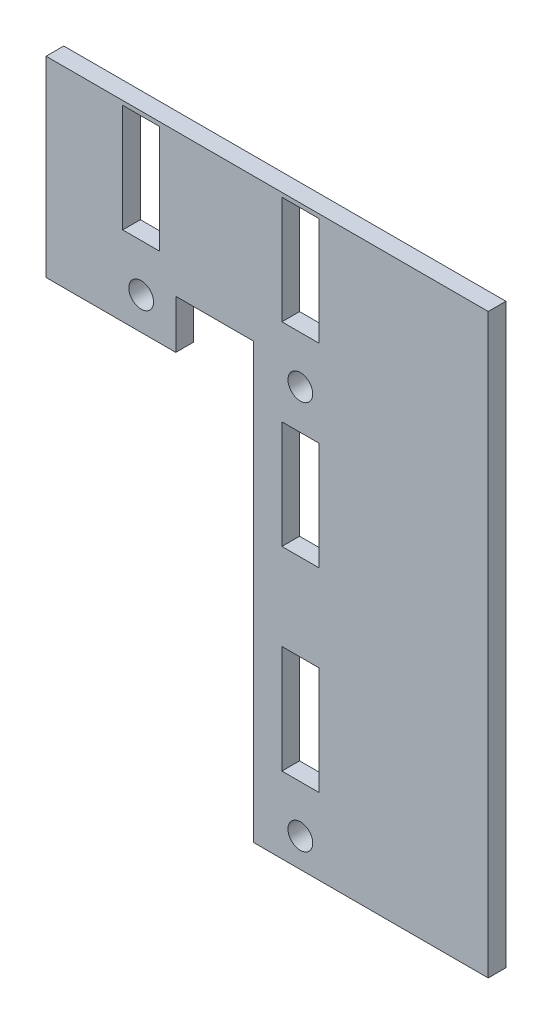
from build123d import *

# Parameters (mm, degrees)
SKETCH1_W           = 101.6
SKETCH1_H           = 50.8
BOSS_EXTRUDE1_DEPTH = 2.54
SKETCH2_R           = 1.778
CUT_EXTRUDE1_DEPTH  = 57.852894385
SKETCH3_W           = 5.3
SKETCH3_H           = 15.5
CUT_EXTRUDE4_DEPTH  = 57.852894385
CUT_EXTRUDE5_DEPTH  = 57.852894385
SKETCH6_W           = 12.7
SKETCH6_H           = 82.902
BOSS_EXTRUDE5_DEPTH = 2.54


with BuildPart() as part:
    # Sketch1 → Boss-Extrude1 (new body)
    with BuildSketch(Plane(origin=(0, 0, 0), x_dir=(0, 1, 0), z_dir=(0, 0, 1))):
        Rectangle(SKETCH1_W, SKETCH1_H)
    extrude(amount=BOSS_EXTRUDE1_DEPTH)

    # Sketch2 → Cut-Extrude1 (cut, through all)
    with BuildSketch(Plane.XY.offset(2.54)):
        with Locations((11.115903034, 27.94)):
            Circle(SKETCH2_R)
        with Locations((11.115903034, -27.94)):
            Circle(SKETCH2_R)
        with Locations((-11.744096966, 27.94)):
            Circle(SKETCH2_R)
    extrude(amount=-CUT_EXTRUDE1_DEPTH, mode=Mode.SUBTRACT)

    # Sketch3 → Cut-Extrude4 (cut, through all)
    with BuildSketch(Plane.XY.offset(2.54)):
        with Locations((11.115903034, -13.43)):
            Rectangle(SKETCH3_W, SKETCH3_H)
        with Locations((11.115903034, 14.51)):
            Rectangle(SKETCH3_W, SKETCH3_H)
        with Locations((11.115903034, 42.45)):
            Rectangle(SKETCH3_W, SKETCH3_H)
        with Locations((-11.744096966, 42.45)):
            Rectangle(SKETCH3_W, SKETCH3_H)
    extrude(amount=-CUT_EXTRUDE4_DEPTH, mode=Mode.SUBTRACT)

    # Sketch5 → Cut-Extrude5 (cut, through all)
    with BuildSketch(Plane.XY.offset(2.54)):
        Polygon((4.401903034, -32.102), (4.401903034, 30.255), (-6.774096966, 30.255), (-6.774096966, 23.27), (-25.4, 23.27), (-25.4, -50.8), (25.4, -50.8), (25.4, -32.102), align=None)
    extrude(amount=-CUT_EXTRUDE5_DEPTH, mode=Mode.SUBTRACT)

    # Sketch6 → Boss-Extrude5 (add)
    with BuildSketch(Plane.XY.offset(2.54)):
        with Locations((31.75, 9.349)):
            Rectangle(SKETCH6_W, SKETCH6_H)
    extrude(amount=-BOSS_EXTRUDE5_DEPTH)


solid = part.part
